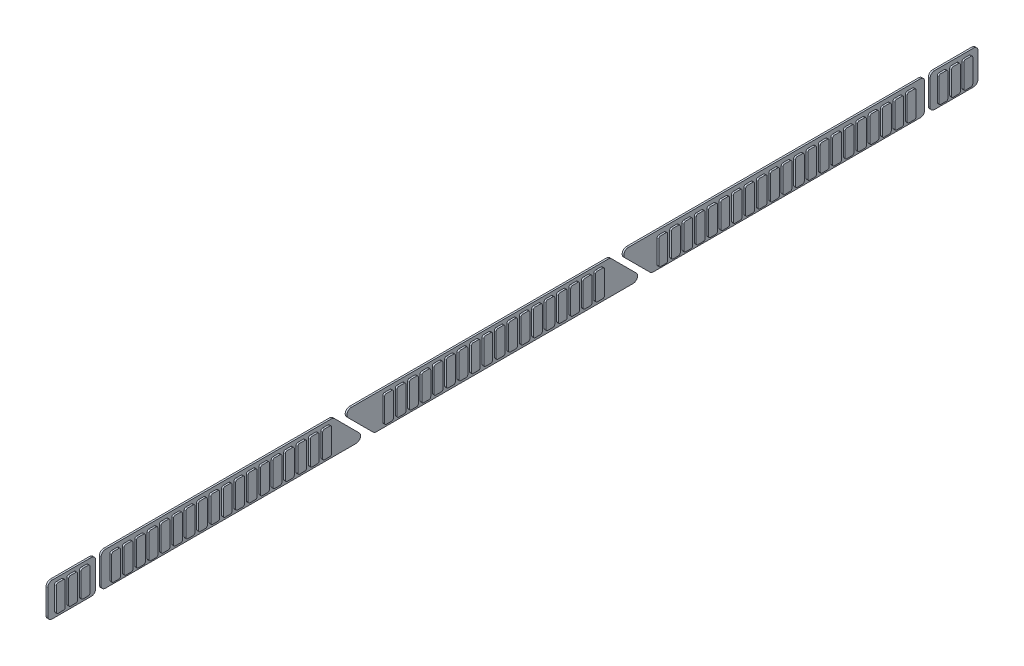
from build123d import *

# Parameters (mm, degrees)
BOSS_EXTRUDE6_DEPTH   = 1
BOSS_EXTRUDE6_2_DEPTH = 1
BOSS_EXTRUDE6_3_DEPTH = 1
BOSS_EXTRUDE6_4_DEPTH = 1
BOSS_EXTRUDE6_5_DEPTH = 1
BOSS_EXTRUDE7_DEPTH   = 1


with BuildPart() as part:
    # Sketch1 → Boss-Extrude6 (new body)
    with BuildSketch(Plane(origin=(0, 0, 0), x_dir=(0, 0, -1), z_dir=(1, 0, 0))):
        with BuildLine():
            Line((-262, 7), (-262, -7))
            ThreePointArc((-262, -7), (-261.267766953, -8.767766953), (-259.5, -9.5))
            Line((-259.5, -9.5), (-237.5, -9.5))
            ThreePointArc((-237.5, -9.5), (-235.732233047, -8.767766953), (-235, -7))
            Line((-235, -7), (-235, 7))
            ThreePointArc((-235, 7), (-235.732233047, 8.767766953), (-237.5, 9.5))
            Line((-237.5, 9.5), (-259.5, 9.5))
            ThreePointArc((-259.5, 9.5), (-261.267766953, 8.767766953), (-262, 7))
        make_face()
    extrude(amount=-BOSS_EXTRUDE6_DEPTH)



with BuildPart() as body_2:
    # Sketch1 → Boss-Extrude6 2 (new body)
    with BuildSketch(Plane(origin=(0, 0, 0), x_dir=(0, 0, -1), z_dir=(1, 0, 0))):
        with BuildLine():
            ThreePointArc((259.5, -9.5), (261.267766953, -8.767766953), (262, -7))
            Line((262, -7), (262, 7))
            ThreePointArc((262, 7), (261.267766953, 8.767766953), (259.5, 9.5))
            Line((259.5, 9.5), (237.5, 9.5))
            ThreePointArc((237.5, 9.5), (235.732233047, 8.767766953), (235, 7))
            Line((235, 7), (235, -7))
            ThreePointArc((235, -7), (235.732233047, -8.767766953), (237.5, -9.5))
            Line((237.5, -9.5), (259.5, -9.5))
        make_face()
    extrude(amount=-BOSS_EXTRUDE6_2_DEPTH)


with BuildPart() as body_3:
    # Sketch1 → Boss-Extrude6 3 (new body)
    with BuildSketch(Plane(origin=(0, 0, 0), x_dir=(0, 0, -1), z_dir=(1, 0, 0))):
        with BuildLine():
            ThreePointArc((-229.5, 9.5), (-231.267766953, 8.767766953), (-232, 7))
            Line((-232, 7), (-232, -7))
            ThreePointArc((-232, -7), (-231.267766953, -8.767766953), (-229.5, -9.5))
            Line((-229.5, -9.5), (-88.278174593, -9.5))
            ThreePointArc((-88.278174593, -9.5), (-85.968475762, -7.956708581), (-86.51040764, -5.232233047))
            Line((-86.51040764, -5.232233047), (-100.51040764, 8.767766953))
            ThreePointArc((-100.51040764, 8.767766953), (-101.321466012, 9.309698831), (-102.278174593, 9.5))
            Line((-102.278174593, 9.5), (-229.5, 9.5))
        make_face()
    extrude(amount=-BOSS_EXTRUDE6_3_DEPTH)


with BuildPart() as body_4:
    # Sketch1 → Boss-Extrude6 4 (new body)
    with BuildSketch(Plane(origin=(0, 0, 0), x_dir=(0, 0, -1), z_dir=(1, 0, 0))):
        with BuildLine():
            ThreePointArc((-78.732233047, -8.767766953), (-77.921174675, -9.309698831), (-76.964466094, -9.5))
            Line((-76.964466094, -9.5), (67.721825407, -9.5))
            ThreePointArc((67.721825407, -9.5), (70.031524238, -7.956708581), (69.48959236, -5.232233047))
            Line((69.48959236, -5.232233047), (55.48959236, 8.767766953))
            ThreePointArc((55.48959236, 8.767766953), (54.678533988, 9.309698831), (53.721825407, 9.5))
            Line((53.721825407, 9.5), (-90.964466094, 9.5))
            ThreePointArc((-90.964466094, 9.5), (-93.274164925, 7.956708581), (-92.732233047, 5.232233047))
            Line((-92.732233047, 5.232233047), (-78.732233047, -8.767766953))
        make_face()
    extrude(amount=-BOSS_EXTRUDE6_4_DEPTH)


with BuildPart() as body_5:
    # Sketch1 → Boss-Extrude6 5 (new body)
    with BuildSketch(Plane(origin=(0, 0, 0), x_dir=(0, 0, -1), z_dir=(1, 0, 0))):
        with BuildLine():
            Line((232, -7), (232, 7))
            ThreePointArc((232, 7), (231.267766953, 8.767766953), (229.5, 9.5))
            Line((229.5, 9.5), (65.035533906, 9.5))
            ThreePointArc((65.035533906, 9.5), (62.725835075, 7.956708581), (63.267766953, 5.232233047))
            Line((63.267766953, 5.232233047), (77.267766953, -8.767766953))
            ThreePointArc((77.267766953, -8.767766953), (78.078825325, -9.309698831), (79.035533906, -9.5))
            Line((79.035533906, -9.5), (229.5, -9.5))
            ThreePointArc((229.5, -9.5), (231.267766953, -8.767766953), (232, -7))
        make_face()
    extrude(amount=-BOSS_EXTRUDE6_5_DEPTH)


with BuildPart() as part_1:
    add(part.part)

    add(body_2.part)  # Boss-Extrude7 merges body 2

    add(body_3.part)  # Boss-Extrude7 merges body 3

    add(body_4.part)  # Boss-Extrude7 merges body 4

    add(body_5.part)  # Boss-Extrude7 merges body 5
    # Sketch1<9> → Boss-Extrude7 (add)
    with BuildSketch(Plane(origin=(0, 0, 0), x_dir=(0, 0, -1), z_dir=(1, 0, 0))):
        with BuildLine():
            Line((-254.193203151, 7.577779114), (-257.193203151, 7.577779114))
            ThreePointArc((-257.193203151, 7.577779114), (-257.900309932, 7.284885895), (-258.193203151, 6.577779114))
            Line((-258.193203151, 6.577779114), (-258.193203151, -6.422220886))
            ThreePointArc((-258.193203151, -6.422220886), (-257.900309932, -7.129327668), (-257.193203151, -7.422220886))
            Line((-257.193203151, -7.422220886), (-254.193203151, -7.422220886))
            ThreePointArc((-254.193203151, -7.422220886), (-253.48609637, -7.129327668), (-253.193203151, -6.422220886))
            Line((-253.193203151, -6.422220886), (-253.193203151, 6.577779114))
            ThreePointArc((-253.193203151, 6.577779114), (-253.48609637, 7.284885895), (-254.193203151, 7.577779114))
        make_face()
        with BuildLine():
            Line((-247.193203151, 7.577779114), (-250.193203151, 7.577779114))
            ThreePointArc((-250.193203151, 7.577779114), (-250.900309932, 7.284885895), (-251.193203151, 6.577779114))
            Line((-251.193203151, 6.577779114), (-251.193203151, -6.422220886))
            ThreePointArc((-251.193203151, -6.422220886), (-250.900309932, -7.129327668), (-250.193203151, -7.422220886))
            Line((-250.193203151, -7.422220886), (-247.193203151, -7.422220886))
            ThreePointArc((-247.193203151, -7.422220886), (-246.48609637, -7.129327668), (-246.193203151, -6.422220886))
            Line((-246.193203151, -6.422220886), (-246.193203151, 6.577779114))
            ThreePointArc((-246.193203151, 6.577779114), (-246.48609637, 7.284885895), (-247.193203151, 7.577779114))
        make_face()
        with BuildLine():
            Line((-240.193203151, 7.577779114), (-243.193203151, 7.577779114))
            ThreePointArc((-243.193203151, 7.577779114), (-243.900309932, 7.284885895), (-244.193203151, 6.577779114))
            Line((-244.193203151, 6.577779114), (-244.193203151, -6.422220886))
            ThreePointArc((-244.193203151, -6.422220886), (-243.900309932, -7.129327668), (-243.193203151, -7.422220886))
            Line((-243.193203151, -7.422220886), (-240.193203151, -7.422220886))
            ThreePointArc((-240.193203151, -7.422220886), (-239.48609637, -7.129327668), (-239.193203151, -6.422220886))
            Line((-239.193203151, -6.422220886), (-239.193203151, 6.577779114))
            ThreePointArc((-239.193203151, 6.577779114), (-239.48609637, 7.284885895), (-240.193203151, 7.577779114))
        make_face()
        with BuildLine():
            Line((-222.991592166, 7.16130422), (-225.991592166, 7.16130422))
            ThreePointArc((-225.991592166, 7.16130422), (-226.698698947, 6.868411001), (-226.991592166, 6.16130422))
            Line((-226.991592166, 6.16130422), (-226.991592166, -6.83869578))
            ThreePointArc((-226.991592166, -6.83869578), (-226.698698947, -7.545802561), (-225.991592166, -7.83869578))
            Line((-225.991592166, -7.83869578), (-222.991592166, -7.83869578))
            ThreePointArc((-222.991592166, -7.83869578), (-222.284485385, -7.545802561), (-221.991592166, -6.83869578))
            Line((-221.991592166, -6.83869578), (-221.991592166, 6.16130422))
            ThreePointArc((-221.991592166, 6.16130422), (-222.284485385, 6.868411001), (-222.991592166, 7.16130422))
        make_face()
        with BuildLine():
            Line((-215.991592166, 7.16130422), (-218.991592166, 7.16130422))
            ThreePointArc((-218.991592166, 7.16130422), (-219.698698947, 6.868411001), (-219.991592166, 6.16130422))
            Line((-219.991592166, 6.16130422), (-219.991592166, -6.83869578))
            ThreePointArc((-219.991592166, -6.83869578), (-219.698698947, -7.545802561), (-218.991592166, -7.83869578))
            Line((-218.991592166, -7.83869578), (-215.991592166, -7.83869578))
            ThreePointArc((-215.991592166, -7.83869578), (-215.284485385, -7.545802561), (-214.991592166, -6.83869578))
            Line((-214.991592166, -6.83869578), (-214.991592166, 6.16130422))
            ThreePointArc((-214.991592166, 6.16130422), (-215.284485385, 6.868411001), (-215.991592166, 7.16130422))
        make_face()
        with BuildLine():
            Line((-208.991592166, 7.16130422), (-211.991592166, 7.16130422))
            ThreePointArc((-211.991592166, 7.16130422), (-212.698698947, 6.868411001), (-212.991592166, 6.16130422))
            Line((-212.991592166, 6.16130422), (-212.991592166, -6.83869578))
            ThreePointArc((-212.991592166, -6.83869578), (-212.698698947, -7.545802561), (-211.991592166, -7.83869578))
            Line((-211.991592166, -7.83869578), (-208.991592166, -7.83869578))
            ThreePointArc((-208.991592166, -7.83869578), (-208.284485385, -7.545802561), (-207.991592166, -6.83869578))
            Line((-207.991592166, -6.83869578), (-207.991592166, 6.16130422))
            ThreePointArc((-207.991592166, 6.16130422), (-208.284485385, 6.868411001), (-208.991592166, 7.16130422))
        make_face()
        with BuildLine():
            Line((-201.991592166, 7.16130422), (-204.991592166, 7.16130422))
            ThreePointArc((-204.991592166, 7.16130422), (-205.698698947, 6.868411001), (-205.991592166, 6.16130422))
            Line((-205.991592166, 6.16130422), (-205.991592166, -6.83869578))
            ThreePointArc((-205.991592166, -6.83869578), (-205.698698947, -7.545802561), (-204.991592166, -7.83869578))
            Line((-204.991592166, -7.83869578), (-201.991592166, -7.83869578))
            ThreePointArc((-201.991592166, -7.83869578), (-201.284485385, -7.545802561), (-200.991592166, -6.83869578))
            Line((-200.991592166, -6.83869578), (-200.991592166, 6.16130422))
            ThreePointArc((-200.991592166, 6.16130422), (-201.284485385, 6.868411001), (-201.991592166, 7.16130422))
        make_face()
        with BuildLine():
            Line((-195.138299605, 7.469188009), (-198.138299605, 7.469188009))
            ThreePointArc((-198.138299605, 7.469188009), (-198.845406387, 7.17629479), (-199.138299605, 6.469188009))
            Line((-199.138299605, 6.469188009), (-199.138299605, -6.530811991))
            ThreePointArc((-199.138299605, -6.530811991), (-198.845406387, -7.237918772), (-198.138299605, -7.530811991))
            Line((-198.138299605, -7.530811991), (-195.138299605, -7.530811991))
            ThreePointArc((-195.138299605, -7.530811991), (-194.431192824, -7.237918772), (-194.138299605, -6.530811991))
            Line((-194.138299605, -6.530811991), (-194.138299605, 6.469188009))
            ThreePointArc((-194.138299605, 6.469188009), (-194.431192824, 7.17629479), (-195.138299605, 7.469188009))
        make_face()
        with BuildLine():
            Line((-188.138299605, 7.469188009), (-191.138299605, 7.469188009))
            ThreePointArc((-191.138299605, 7.469188009), (-191.845406387, 7.17629479), (-192.138299605, 6.469188009))
            Line((-192.138299605, 6.469188009), (-192.138299605, -6.530811991))
            ThreePointArc((-192.138299605, -6.530811991), (-191.845406387, -7.237918772), (-191.138299605, -7.530811991))
            Line((-191.138299605, -7.530811991), (-188.138299605, -7.530811991))
            ThreePointArc((-188.138299605, -7.530811991), (-187.431192824, -7.237918772), (-187.138299605, -6.530811991))
            Line((-187.138299605, -6.530811991), (-187.138299605, 6.469188009))
            ThreePointArc((-187.138299605, 6.469188009), (-187.431192824, 7.17629479), (-188.138299605, 7.469188009))
        make_face()
        with BuildLine():
            Line((-181.138299605, 7.469188009), (-184.138299605, 7.469188009))
            ThreePointArc((-184.138299605, 7.469188009), (-184.845406387, 7.17629479), (-185.138299605, 6.469188009))
            Line((-185.138299605, 6.469188009), (-185.138299605, -6.530811991))
            ThreePointArc((-185.138299605, -6.530811991), (-184.845406387, -7.237918772), (-184.138299605, -7.530811991))
            Line((-184.138299605, -7.530811991), (-181.138299605, -7.530811991))
            ThreePointArc((-181.138299605, -7.530811991), (-180.431192824, -7.237918772), (-180.138299605, -6.530811991))
            Line((-180.138299605, -6.530811991), (-180.138299605, 6.469188009))
            ThreePointArc((-180.138299605, 6.469188009), (-180.431192824, 7.17629479), (-181.138299605, 7.469188009))
        make_face()
        with BuildLine():
            Line((-174.138299605, 7.469188009), (-177.138299605, 7.469188009))
            ThreePointArc((-177.138299605, 7.469188009), (-177.845406387, 7.17629479), (-178.138299605, 6.469188009))
            Line((-178.138299605, 6.469188009), (-178.138299605, -6.530811991))
            ThreePointArc((-178.138299605, -6.530811991), (-177.845406387, -7.237918772), (-177.138299605, -7.530811991))
            Line((-177.138299605, -7.530811991), (-174.138299605, -7.530811991))
            ThreePointArc((-174.138299605, -7.530811991), (-173.431192824, -7.237918772), (-173.138299605, -6.530811991))
            Line((-173.138299605, -6.530811991), (-173.138299605, 6.469188009))
            ThreePointArc((-173.138299605, 6.469188009), (-173.431192824, 7.17629479), (-174.138299605, 7.469188009))
        make_face()
        with BuildLine():
            Line((-167.138299605, 7.469188009), (-170.138299605, 7.469188009))
            ThreePointArc((-170.138299605, 7.469188009), (-170.845406387, 7.17629479), (-171.138299605, 6.469188009))
            Line((-171.138299605, 6.469188009), (-171.138299605, -6.530811991))
            ThreePointArc((-171.138299605, -6.530811991), (-170.845406387, -7.237918772), (-170.138299605, -7.530811991))
            Line((-170.138299605, -7.530811991), (-167.138299605, -7.530811991))
            ThreePointArc((-167.138299605, -7.530811991), (-166.431192824, -7.237918772), (-166.138299605, -6.530811991))
            Line((-166.138299605, -6.530811991), (-166.138299605, 6.469188009))
            ThreePointArc((-166.138299605, 6.469188009), (-166.431192824, 7.17629479), (-167.138299605, 7.469188009))
        make_face()
        with BuildLine():
            Line((-160.138299605, 7.469188009), (-163.138299605, 7.469188009))
            ThreePointArc((-163.138299605, 7.469188009), (-163.845406387, 7.17629479), (-164.138299605, 6.469188009))
            Line((-164.138299605, 6.469188009), (-164.138299605, -6.530811991))
            ThreePointArc((-164.138299605, -6.530811991), (-163.845406387, -7.237918772), (-163.138299605, -7.530811991))
            Line((-163.138299605, -7.530811991), (-160.138299605, -7.530811991))
            ThreePointArc((-160.138299605, -7.530811991), (-159.431192824, -7.237918772), (-159.138299605, -6.530811991))
            Line((-159.138299605, -6.530811991), (-159.138299605, 6.469188009))
            ThreePointArc((-159.138299605, 6.469188009), (-159.431192824, 7.17629479), (-160.138299605, 7.469188009))
        make_face()
        with BuildLine():
            Line((-153.138299605, 7.469188009), (-156.138299605, 7.469188009))
            ThreePointArc((-156.138299605, 7.469188009), (-156.845406387, 7.17629479), (-157.138299605, 6.469188009))
            Line((-157.138299605, 6.469188009), (-157.138299605, -6.530811991))
            ThreePointArc((-157.138299605, -6.530811991), (-156.845406387, -7.237918772), (-156.138299605, -7.530811991))
            Line((-156.138299605, -7.530811991), (-153.138299605, -7.530811991))
            ThreePointArc((-153.138299605, -7.530811991), (-152.431192824, -7.237918772), (-152.138299605, -6.530811991))
            Line((-152.138299605, -6.530811991), (-152.138299605, 6.469188009))
            ThreePointArc((-152.138299605, 6.469188009), (-152.431192824, 7.17629479), (-153.138299605, 7.469188009))
        make_face()
        with BuildLine():
            Line((-146.138299605, 7.469188009), (-149.138299605, 7.469188009))
            ThreePointArc((-149.138299605, 7.469188009), (-149.845406387, 7.17629479), (-150.138299605, 6.469188009))
            Line((-150.138299605, 6.469188009), (-150.138299605, -6.530811991))
            ThreePointArc((-150.138299605, -6.530811991), (-149.845406387, -7.237918772), (-149.138299605, -7.530811991))
            Line((-149.138299605, -7.530811991), (-146.138299605, -7.530811991))
            ThreePointArc((-146.138299605, -7.530811991), (-145.431192824, -7.237918772), (-145.138299605, -6.530811991))
            Line((-145.138299605, -6.530811991), (-145.138299605, 6.469188009))
            ThreePointArc((-145.138299605, 6.469188009), (-145.431192824, 7.17629479), (-146.138299605, 7.469188009))
        make_face()
        with BuildLine():
            Line((-139.138299605, 7.469188009), (-142.138299605, 7.469188009))
            ThreePointArc((-142.138299605, 7.469188009), (-142.845406387, 7.17629479), (-143.138299605, 6.469188009))
            Line((-143.138299605, 6.469188009), (-143.138299605, -6.530811991))
            ThreePointArc((-143.138299605, -6.530811991), (-142.845406387, -7.237918772), (-142.138299605, -7.530811991))
            Line((-142.138299605, -7.530811991), (-139.138299605, -7.530811991))
            ThreePointArc((-139.138299605, -7.530811991), (-138.431192824, -7.237918772), (-138.138299605, -6.530811991))
            Line((-138.138299605, -6.530811991), (-138.138299605, 6.469188009))
            ThreePointArc((-138.138299605, 6.469188009), (-138.431192824, 7.17629479), (-139.138299605, 7.469188009))
        make_face()
        with BuildLine():
            Line((-132.138299605, 7.469188009), (-135.138299605, 7.469188009))
            ThreePointArc((-135.138299605, 7.469188009), (-135.845406387, 7.17629479), (-136.138299605, 6.469188009))
            Line((-136.138299605, 6.469188009), (-136.138299605, -6.530811991))
            ThreePointArc((-136.138299605, -6.530811991), (-135.845406387, -7.237918772), (-135.138299605, -7.530811991))
            Line((-135.138299605, -7.530811991), (-132.138299605, -7.530811991))
            ThreePointArc((-132.138299605, -7.530811991), (-131.431192824, -7.237918772), (-131.138299605, -6.530811991))
            Line((-131.138299605, -6.530811991), (-131.138299605, 6.469188009))
            ThreePointArc((-131.138299605, 6.469188009), (-131.431192824, 7.17629479), (-132.138299605, 7.469188009))
        make_face()
        with BuildLine():
            Line((-125.138299605, 7.469188009), (-128.138299605, 7.469188009))
            ThreePointArc((-128.138299605, 7.469188009), (-128.845406387, 7.17629479), (-129.138299605, 6.469188009))
            Line((-129.138299605, 6.469188009), (-129.138299605, -6.530811991))
            ThreePointArc((-129.138299605, -6.530811991), (-128.845406387, -7.237918772), (-128.138299605, -7.530811991))
            Line((-128.138299605, -7.530811991), (-125.138299605, -7.530811991))
            ThreePointArc((-125.138299605, -7.530811991), (-124.431192824, -7.237918772), (-124.138299605, -6.530811991))
            Line((-124.138299605, -6.530811991), (-124.138299605, 6.469188009))
            ThreePointArc((-124.138299605, 6.469188009), (-124.431192824, 7.17629479), (-125.138299605, 7.469188009))
        make_face()
        with BuildLine():
            Line((-118.138299605, 7.469188009), (-121.138299605, 7.469188009))
            ThreePointArc((-121.138299605, 7.469188009), (-121.845406387, 7.17629479), (-122.138299605, 6.469188009))
            Line((-122.138299605, 6.469188009), (-122.138299605, -6.530811991))
            ThreePointArc((-122.138299605, -6.530811991), (-121.845406387, -7.237918772), (-121.138299605, -7.530811991))
            Line((-121.138299605, -7.530811991), (-118.138299605, -7.530811991))
            ThreePointArc((-118.138299605, -7.530811991), (-117.431192824, -7.237918772), (-117.138299605, -6.530811991))
            Line((-117.138299605, -6.530811991), (-117.138299605, 6.469188009))
            ThreePointArc((-117.138299605, 6.469188009), (-117.431192824, 7.17629479), (-118.138299605, 7.469188009))
        make_face()
        with BuildLine():
            Line((-111.138299605, 7.469188009), (-114.138299605, 7.469188009))
            ThreePointArc((-114.138299605, 7.469188009), (-114.845406387, 7.17629479), (-115.138299605, 6.469188009))
            Line((-115.138299605, 6.469188009), (-115.138299605, -6.530811991))
            ThreePointArc((-115.138299605, -6.530811991), (-114.845406387, -7.237918772), (-114.138299605, -7.530811991))
            Line((-114.138299605, -7.530811991), (-111.138299605, -7.530811991))
            ThreePointArc((-111.138299605, -7.530811991), (-110.431192824, -7.237918772), (-110.138299605, -6.530811991))
            Line((-110.138299605, -6.530811991), (-110.138299605, 6.469188009))
            ThreePointArc((-110.138299605, 6.469188009), (-110.431192824, 7.17629479), (-111.138299605, 7.469188009))
        make_face()
        with BuildLine():
            Line((-104.138299605, 7.469188009), (-107.138299605, 7.469188009))
            ThreePointArc((-107.138299605, 7.469188009), (-107.845406387, 7.17629479), (-108.138299605, 6.469188009))
            Line((-108.138299605, 6.469188009), (-108.138299605, -6.530811991))
            ThreePointArc((-108.138299605, -6.530811991), (-107.845406387, -7.237918772), (-107.138299605, -7.530811991))
            Line((-107.138299605, -7.530811991), (-104.138299605, -7.530811991))
            ThreePointArc((-104.138299605, -7.530811991), (-103.431192824, -7.237918772), (-103.138299605, -6.530811991))
            Line((-103.138299605, -6.530811991), (-103.138299605, 6.469188009))
            ThreePointArc((-103.138299605, 6.469188009), (-103.431192824, 7.17629479), (-104.138299605, 7.469188009))
        make_face()
        with BuildLine():
            Line((-69.26358478, 7.369918004), (-72.26358478, 7.369918004))
            ThreePointArc((-72.26358478, 7.369918004), (-72.970691561, 7.077024785), (-73.26358478, 6.369918004))
            Line((-73.26358478, 6.369918004), (-73.26358478, -6.630081996))
            ThreePointArc((-73.26358478, -6.630081996), (-72.970691561, -7.337188777), (-72.26358478, -7.630081996))
            Line((-72.26358478, -7.630081996), (-69.26358478, -7.630081996))
            ThreePointArc((-69.26358478, -7.630081996), (-68.556477999, -7.337188777), (-68.26358478, -6.630081996))
            Line((-68.26358478, -6.630081996), (-68.26358478, 6.369918004))
            ThreePointArc((-68.26358478, 6.369918004), (-68.556477999, 7.077024785), (-69.26358478, 7.369918004))
        make_face()
        with BuildLine():
            Line((-62.26358478, 7.369918004), (-65.26358478, 7.369918004))
            ThreePointArc((-65.26358478, 7.369918004), (-65.970691561, 7.077024785), (-66.26358478, 6.369918004))
            Line((-66.26358478, 6.369918004), (-66.26358478, -6.630081996))
            ThreePointArc((-66.26358478, -6.630081996), (-65.970691561, -7.337188777), (-65.26358478, -7.630081996))
            Line((-65.26358478, -7.630081996), (-62.26358478, -7.630081996))
            ThreePointArc((-62.26358478, -7.630081996), (-61.556477999, -7.337188777), (-61.26358478, -6.630081996))
            Line((-61.26358478, -6.630081996), (-61.26358478, 6.369918004))
            ThreePointArc((-61.26358478, 6.369918004), (-61.556477999, 7.077024785), (-62.26358478, 7.369918004))
        make_face()
        with BuildLine():
            Line((-55.26358478, 7.369918004), (-58.26358478, 7.369918004))
            ThreePointArc((-58.26358478, 7.369918004), (-58.970691561, 7.077024785), (-59.26358478, 6.369918004))
            Line((-59.26358478, 6.369918004), (-59.26358478, -6.630081996))
            ThreePointArc((-59.26358478, -6.630081996), (-58.970691561, -7.337188777), (-58.26358478, -7.630081996))
            Line((-58.26358478, -7.630081996), (-55.26358478, -7.630081996))
            ThreePointArc((-55.26358478, -7.630081996), (-54.556477999, -7.337188777), (-54.26358478, -6.630081996))
            Line((-54.26358478, -6.630081996), (-54.26358478, 6.369918004))
            ThreePointArc((-54.26358478, 6.369918004), (-54.556477999, 7.077024785), (-55.26358478, 7.369918004))
        make_face()
        with BuildLine():
            Line((-48.26358478, 7.369918004), (-51.26358478, 7.369918004))
            ThreePointArc((-51.26358478, 7.369918004), (-51.970691561, 7.077024785), (-52.26358478, 6.369918004))
            Line((-52.26358478, 6.369918004), (-52.26358478, -6.630081996))
            ThreePointArc((-52.26358478, -6.630081996), (-51.970691561, -7.337188777), (-51.26358478, -7.630081996))
            Line((-51.26358478, -7.630081996), (-48.26358478, -7.630081996))
            ThreePointArc((-48.26358478, -7.630081996), (-47.556477999, -7.337188777), (-47.26358478, -6.630081996))
            Line((-47.26358478, -6.630081996), (-47.26358478, 6.369918004))
            ThreePointArc((-47.26358478, 6.369918004), (-47.556477999, 7.077024785), (-48.26358478, 7.369918004))
        make_face()
        with BuildLine():
            Line((-41.410292219, 7.677801793), (-44.410292219, 7.677801793))
            ThreePointArc((-44.410292219, 7.677801793), (-45.117399, 7.384908574), (-45.410292219, 6.677801793))
            Line((-45.410292219, 6.677801793), (-45.410292219, -6.322198207))
            ThreePointArc((-45.410292219, -6.322198207), (-45.117399, -7.029304988), (-44.410292219, -7.322198207))
            Line((-44.410292219, -7.322198207), (-41.410292219, -7.322198207))
            ThreePointArc((-41.410292219, -7.322198207), (-40.703185438, -7.029304988), (-40.410292219, -6.322198207))
            Line((-40.410292219, -6.322198207), (-40.410292219, 6.677801793))
            ThreePointArc((-40.410292219, 6.677801793), (-40.703185438, 7.384908574), (-41.410292219, 7.677801793))
        make_face()
        with BuildLine():
            Line((-34.410292219, 7.677801793), (-37.410292219, 7.677801793))
            ThreePointArc((-37.410292219, 7.677801793), (-38.117399, 7.384908574), (-38.410292219, 6.677801793))
            Line((-38.410292219, 6.677801793), (-38.410292219, -6.322198207))
            ThreePointArc((-38.410292219, -6.322198207), (-38.117399, -7.029304988), (-37.410292219, -7.322198207))
            Line((-37.410292219, -7.322198207), (-34.410292219, -7.322198207))
            ThreePointArc((-34.410292219, -7.322198207), (-33.703185438, -7.029304988), (-33.410292219, -6.322198207))
            Line((-33.410292219, -6.322198207), (-33.410292219, 6.677801793))
            ThreePointArc((-33.410292219, 6.677801793), (-33.703185438, 7.384908574), (-34.410292219, 7.677801793))
        make_face()
        with BuildLine():
            Line((-27.410292219, 7.677801793), (-30.410292219, 7.677801793))
            ThreePointArc((-30.410292219, 7.677801793), (-31.117399, 7.384908574), (-31.410292219, 6.677801793))
            Line((-31.410292219, 6.677801793), (-31.410292219, -6.322198207))
            ThreePointArc((-31.410292219, -6.322198207), (-31.117399, -7.029304988), (-30.410292219, -7.322198207))
            Line((-30.410292219, -7.322198207), (-27.410292219, -7.322198207))
            ThreePointArc((-27.410292219, -7.322198207), (-26.703185438, -7.029304988), (-26.410292219, -6.322198207))
            Line((-26.410292219, -6.322198207), (-26.410292219, 6.677801793))
            ThreePointArc((-26.410292219, 6.677801793), (-26.703185438, 7.384908574), (-27.410292219, 7.677801793))
        make_face()
        with BuildLine():
            Line((-20.410292219, 7.677801793), (-23.410292219, 7.677801793))
            ThreePointArc((-23.410292219, 7.677801793), (-24.117399, 7.384908574), (-24.410292219, 6.677801793))
            Line((-24.410292219, 6.677801793), (-24.410292219, -6.322198207))
            ThreePointArc((-24.410292219, -6.322198207), (-24.117399, -7.029304988), (-23.410292219, -7.322198207))
            Line((-23.410292219, -7.322198207), (-20.410292219, -7.322198207))
            ThreePointArc((-20.410292219, -7.322198207), (-19.703185438, -7.029304988), (-19.410292219, -6.322198207))
            Line((-19.410292219, -6.322198207), (-19.410292219, 6.677801793))
            ThreePointArc((-19.410292219, 6.677801793), (-19.703185438, 7.384908574), (-20.410292219, 7.677801793))
        make_face()
        with BuildLine():
            Line((-13.410292219, 7.677801793), (-16.410292219, 7.677801793))
            ThreePointArc((-16.410292219, 7.677801793), (-17.117399, 7.384908574), (-17.410292219, 6.677801793))
            Line((-17.410292219, 6.677801793), (-17.410292219, -6.322198207))
            ThreePointArc((-17.410292219, -6.322198207), (-17.117399, -7.029304988), (-16.410292219, -7.322198207))
            Line((-16.410292219, -7.322198207), (-13.410292219, -7.322198207))
            ThreePointArc((-13.410292219, -7.322198207), (-12.703185438, -7.029304988), (-12.410292219, -6.322198207))
            Line((-12.410292219, -6.322198207), (-12.410292219, 6.677801793))
            ThreePointArc((-12.410292219, 6.677801793), (-12.703185438, 7.384908574), (-13.410292219, 7.677801793))
        make_face()
        with BuildLine():
            Line((-6.410292219, 7.677801793), (-9.410292219, 7.677801793))
            ThreePointArc((-9.410292219, 7.677801793), (-10.117399, 7.384908574), (-10.410292219, 6.677801793))
            Line((-10.410292219, 6.677801793), (-10.410292219, -6.322198207))
            ThreePointArc((-10.410292219, -6.322198207), (-10.117399, -7.029304988), (-9.410292219, -7.322198207))
            Line((-9.410292219, -7.322198207), (-6.410292219, -7.322198207))
            ThreePointArc((-6.410292219, -7.322198207), (-5.703185438, -7.029304988), (-5.410292219, -6.322198207))
            Line((-5.410292219, -6.322198207), (-5.410292219, 6.677801793))
            ThreePointArc((-5.410292219, 6.677801793), (-5.703185438, 7.384908574), (-6.410292219, 7.677801793))
        make_face()
        with BuildLine():
            Line((0.589707781, 7.677801793), (-2.410292219, 7.677801793))
            ThreePointArc((-2.410292219, 7.677801793), (-3.117399, 7.384908574), (-3.410292219, 6.677801793))
            Line((-3.410292219, 6.677801793), (-3.410292219, -6.322198207))
            ThreePointArc((-3.410292219, -6.322198207), (-3.117399, -7.029304988), (-2.410292219, -7.322198207))
            Line((-2.410292219, -7.322198207), (0.589707781, -7.322198207))
            ThreePointArc((0.589707781, -7.322198207), (1.296814562, -7.029304988), (1.589707781, -6.322198207))
            Line((1.589707781, -6.322198207), (1.589707781, 6.677801793))
            ThreePointArc((1.589707781, 6.677801793), (1.296814562, 7.384908574), (0.589707781, 7.677801793))
        make_face()
        with BuildLine():
            Line((7.589707781, 7.677801793), (4.589707781, 7.677801793))
            ThreePointArc((4.589707781, 7.677801793), (3.882601, 7.384908574), (3.589707781, 6.677801793))
            Line((3.589707781, 6.677801793), (3.589707781, -6.322198207))
            ThreePointArc((3.589707781, -6.322198207), (3.882601, -7.029304988), (4.589707781, -7.322198207))
            Line((4.589707781, -7.322198207), (7.589707781, -7.322198207))
            ThreePointArc((7.589707781, -7.322198207), (8.296814562, -7.029304988), (8.589707781, -6.322198207))
            Line((8.589707781, -6.322198207), (8.589707781, 6.677801793))
            ThreePointArc((8.589707781, 6.677801793), (8.296814562, 7.384908574), (7.589707781, 7.677801793))
        make_face()
        with BuildLine():
            Line((14.589707781, 7.677801793), (11.589707781, 7.677801793))
            ThreePointArc((11.589707781, 7.677801793), (10.882601, 7.384908574), (10.589707781, 6.677801793))
            Line((10.589707781, 6.677801793), (10.589707781, -6.322198207))
            ThreePointArc((10.589707781, -6.322198207), (10.882601, -7.029304988), (11.589707781, -7.322198207))
            Line((11.589707781, -7.322198207), (14.589707781, -7.322198207))
            ThreePointArc((14.589707781, -7.322198207), (15.296814562, -7.029304988), (15.589707781, -6.322198207))
            Line((15.589707781, -6.322198207), (15.589707781, 6.677801793))
            ThreePointArc((15.589707781, 6.677801793), (15.296814562, 7.384908574), (14.589707781, 7.677801793))
        make_face()
        with BuildLine():
            Line((21.589707781, 7.677801793), (18.589707781, 7.677801793))
            ThreePointArc((18.589707781, 7.677801793), (17.882601, 7.384908574), (17.589707781, 6.677801793))
            Line((17.589707781, 6.677801793), (17.589707781, -6.322198207))
            ThreePointArc((17.589707781, -6.322198207), (17.882601, -7.029304988), (18.589707781, -7.322198207))
            Line((18.589707781, -7.322198207), (21.589707781, -7.322198207))
            ThreePointArc((21.589707781, -7.322198207), (22.296814562, -7.029304988), (22.589707781, -6.322198207))
            Line((22.589707781, -6.322198207), (22.589707781, 6.677801793))
            ThreePointArc((22.589707781, 6.677801793), (22.296814562, 7.384908574), (21.589707781, 7.677801793))
        make_face()
        with BuildLine():
            Line((28.589707781, 7.677801793), (25.589707781, 7.677801793))
            ThreePointArc((25.589707781, 7.677801793), (24.882601, 7.384908574), (24.589707781, 6.677801793))
            Line((24.589707781, 6.677801793), (24.589707781, -6.322198207))
            ThreePointArc((24.589707781, -6.322198207), (24.882601, -7.029304988), (25.589707781, -7.322198207))
            Line((25.589707781, -7.322198207), (28.589707781, -7.322198207))
            ThreePointArc((28.589707781, -7.322198207), (29.296814562, -7.029304988), (29.589707781, -6.322198207))
            Line((29.589707781, -6.322198207), (29.589707781, 6.677801793))
            ThreePointArc((29.589707781, 6.677801793), (29.296814562, 7.384908574), (28.589707781, 7.677801793))
        make_face()
        with BuildLine():
            Line((35.589707781, 7.677801793), (32.589707781, 7.677801793))
            ThreePointArc((32.589707781, 7.677801793), (31.882601, 7.384908574), (31.589707781, 6.677801793))
            Line((31.589707781, 6.677801793), (31.589707781, -6.322198207))
            ThreePointArc((31.589707781, -6.322198207), (31.882601, -7.029304988), (32.589707781, -7.322198207))
            Line((32.589707781, -7.322198207), (35.589707781, -7.322198207))
            ThreePointArc((35.589707781, -7.322198207), (36.296814562, -7.029304988), (36.589707781, -6.322198207))
            Line((36.589707781, -6.322198207), (36.589707781, 6.677801793))
            ThreePointArc((36.589707781, 6.677801793), (36.296814562, 7.384908574), (35.589707781, 7.677801793))
        make_face()
        with BuildLine():
            Line((42.589707781, 7.677801793), (39.589707781, 7.677801793))
            ThreePointArc((39.589707781, 7.677801793), (38.882601, 7.384908574), (38.589707781, 6.677801793))
            Line((38.589707781, 6.677801793), (38.589707781, -6.322198207))
            ThreePointArc((38.589707781, -6.322198207), (38.882601, -7.029304988), (39.589707781, -7.322198207))
            Line((39.589707781, -7.322198207), (42.589707781, -7.322198207))
            ThreePointArc((42.589707781, -7.322198207), (43.296814562, -7.029304988), (43.589707781, -6.322198207))
            Line((43.589707781, -6.322198207), (43.589707781, 6.677801793))
            ThreePointArc((43.589707781, 6.677801793), (43.296814562, 7.384908574), (42.589707781, 7.677801793))
        make_face()
        with BuildLine():
            Line((49.589707781, 7.677801793), (46.589707781, 7.677801793))
            ThreePointArc((46.589707781, 7.677801793), (45.882601, 7.384908574), (45.589707781, 6.677801793))
            Line((45.589707781, 6.677801793), (45.589707781, -6.322198207))
            ThreePointArc((45.589707781, -6.322198207), (45.882601, -7.029304988), (46.589707781, -7.322198207))
            Line((46.589707781, -7.322198207), (49.589707781, -7.322198207))
            ThreePointArc((49.589707781, -7.322198207), (50.296814562, -7.029304988), (50.589707781, -6.322198207))
            Line((50.589707781, -6.322198207), (50.589707781, 6.677801793))
            ThreePointArc((50.589707781, 6.677801793), (50.296814562, 7.384908574), (49.589707781, 7.677801793))
        make_face()
        with BuildLine():
            Line((92.284036077, 7.221339048), (89.284036077, 7.221339048))
            ThreePointArc((89.284036077, 7.221339048), (88.576929296, 6.928445829), (88.284036077, 6.221339048))
            Line((88.284036077, 6.221339048), (88.284036077, -6.778660952))
            ThreePointArc((88.284036077, -6.778660952), (88.576929296, -7.485767733), (89.284036077, -7.778660952))
            Line((89.284036077, -7.778660952), (92.284036077, -7.778660952))
            ThreePointArc((92.284036077, -7.778660952), (92.991142858, -7.485767733), (93.284036077, -6.778660952))
            Line((93.284036077, -6.778660952), (93.284036077, 6.221339048))
            ThreePointArc((93.284036077, 6.221339048), (92.991142858, 6.928445829), (92.284036077, 7.221339048))
        make_face()
        with BuildLine():
            Line((99.284036077, 7.221339048), (96.284036077, 7.221339048))
            ThreePointArc((96.284036077, 7.221339048), (95.576929296, 6.928445829), (95.284036077, 6.221339048))
            Line((95.284036077, 6.221339048), (95.284036077, -6.778660952))
            ThreePointArc((95.284036077, -6.778660952), (95.576929296, -7.485767733), (96.284036077, -7.778660952))
            Line((96.284036077, -7.778660952), (99.284036077, -7.778660952))
            ThreePointArc((99.284036077, -7.778660952), (99.991142858, -7.485767733), (100.284036077, -6.778660952))
            Line((100.284036077, -6.778660952), (100.284036077, 6.221339048))
            ThreePointArc((100.284036077, 6.221339048), (99.991142858, 6.928445829), (99.284036077, 7.221339048))
        make_face()
        with BuildLine():
            Line((106.284036077, 7.221339048), (103.284036077, 7.221339048))
            ThreePointArc((103.284036077, 7.221339048), (102.576929296, 6.928445829), (102.284036077, 6.221339048))
            Line((102.284036077, 6.221339048), (102.284036077, -6.778660952))
            ThreePointArc((102.284036077, -6.778660952), (102.576929296, -7.485767733), (103.284036077, -7.778660952))
            Line((103.284036077, -7.778660952), (106.284036077, -7.778660952))
            ThreePointArc((106.284036077, -7.778660952), (106.991142858, -7.485767733), (107.284036077, -6.778660952))
            Line((107.284036077, -6.778660952), (107.284036077, 6.221339048))
            ThreePointArc((107.284036077, 6.221339048), (106.991142858, 6.928445829), (106.284036077, 7.221339048))
        make_face()
        with BuildLine():
            Line((113.284036077, 7.221339048), (110.284036077, 7.221339048))
            ThreePointArc((110.284036077, 7.221339048), (109.576929296, 6.928445829), (109.284036077, 6.221339048))
            Line((109.284036077, 6.221339048), (109.284036077, -6.778660952))
            ThreePointArc((109.284036077, -6.778660952), (109.576929296, -7.485767733), (110.284036077, -7.778660952))
            Line((110.284036077, -7.778660952), (113.284036077, -7.778660952))
            ThreePointArc((113.284036077, -7.778660952), (113.991142858, -7.485767733), (114.284036077, -6.778660952))
            Line((114.284036077, -6.778660952), (114.284036077, 6.221339048))
            ThreePointArc((114.284036077, 6.221339048), (113.991142858, 6.928445829), (113.284036077, 7.221339048))
        make_face()
        with BuildLine():
            Line((120.137328638, 7.221339048), (117.137328638, 7.221339048))
            ThreePointArc((117.137328638, 7.221339048), (116.430221857, 6.928445829), (116.137328638, 6.221339048))
            Line((116.137328638, 6.221339048), (116.137328638, -6.778660952))
            ThreePointArc((116.137328638, -6.778660952), (116.430221857, -7.485767733), (117.137328638, -7.778660952))
            Line((117.137328638, -7.778660952), (120.137328638, -7.778660952))
            ThreePointArc((120.137328638, -7.778660952), (120.844435419, -7.485767733), (121.137328638, -6.778660952))
            Line((121.137328638, -6.778660952), (121.137328638, 6.221339048))
            ThreePointArc((121.137328638, 6.221339048), (120.844435419, 6.928445829), (120.137328638, 7.221339048))
        make_face()
        with BuildLine():
            Line((127.137328638, 7.221339048), (124.137328638, 7.221339048))
            ThreePointArc((124.137328638, 7.221339048), (123.430221857, 6.928445829), (123.137328638, 6.221339048))
            Line((123.137328638, 6.221339048), (123.137328638, -6.778660952))
            ThreePointArc((123.137328638, -6.778660952), (123.430221857, -7.485767733), (124.137328638, -7.778660952))
            Line((124.137328638, -7.778660952), (127.137328638, -7.778660952))
            ThreePointArc((127.137328638, -7.778660952), (127.844435419, -7.485767733), (128.137328638, -6.778660952))
            Line((128.137328638, -6.778660952), (128.137328638, 6.221339048))
            ThreePointArc((128.137328638, 6.221339048), (127.844435419, 6.928445829), (127.137328638, 7.221339048))
        make_face()
        with BuildLine():
            Line((134.137328638, 7.221339048), (131.137328638, 7.221339048))
            ThreePointArc((131.137328638, 7.221339048), (130.430221857, 6.928445829), (130.137328638, 6.221339048))
            Line((130.137328638, 6.221339048), (130.137328638, -6.778660952))
            ThreePointArc((130.137328638, -6.778660952), (130.430221857, -7.485767733), (131.137328638, -7.778660952))
            Line((131.137328638, -7.778660952), (134.137328638, -7.778660952))
            ThreePointArc((134.137328638, -7.778660952), (134.844435419, -7.485767733), (135.137328638, -6.778660952))
            Line((135.137328638, -6.778660952), (135.137328638, 6.221339048))
            ThreePointArc((135.137328638, 6.221339048), (134.844435419, 6.928445829), (134.137328638, 7.221339048))
        make_face()
        with BuildLine():
            Line((141.137328638, 7.221339048), (138.137328638, 7.221339048))
            ThreePointArc((138.137328638, 7.221339048), (137.430221857, 6.928445829), (137.137328638, 6.221339048))
            Line((137.137328638, 6.221339048), (137.137328638, -6.778660952))
            ThreePointArc((137.137328638, -6.778660952), (137.430221857, -7.485767733), (138.137328638, -7.778660952))
            Line((138.137328638, -7.778660952), (141.137328638, -7.778660952))
            ThreePointArc((141.137328638, -7.778660952), (141.844435419, -7.485767733), (142.137328638, -6.778660952))
            Line((142.137328638, -6.778660952), (142.137328638, 6.221339048))
            ThreePointArc((142.137328638, 6.221339048), (141.844435419, 6.928445829), (141.137328638, 7.221339048))
        make_face()
        with BuildLine():
            Line((148.137328638, 7.221339048), (145.137328638, 7.221339048))
            ThreePointArc((145.137328638, 7.221339048), (144.430221857, 6.928445829), (144.137328638, 6.221339048))
            Line((144.137328638, 6.221339048), (144.137328638, -6.778660952))
            ThreePointArc((144.137328638, -6.778660952), (144.430221857, -7.485767733), (145.137328638, -7.778660952))
            Line((145.137328638, -7.778660952), (148.137328638, -7.778660952))
            ThreePointArc((148.137328638, -7.778660952), (148.844435419, -7.485767733), (149.137328638, -6.778660952))
            Line((149.137328638, -6.778660952), (149.137328638, 6.221339048))
            ThreePointArc((149.137328638, 6.221339048), (148.844435419, 6.928445829), (148.137328638, 7.221339048))
        make_face()
        with BuildLine():
            Line((155.137328638, 7.221339048), (152.137328638, 7.221339048))
            ThreePointArc((152.137328638, 7.221339048), (151.430221857, 6.928445829), (151.137328638, 6.221339048))
            Line((151.137328638, 6.221339048), (151.137328638, -6.778660952))
            ThreePointArc((151.137328638, -6.778660952), (151.430221857, -7.485767733), (152.137328638, -7.778660952))
            Line((152.137328638, -7.778660952), (155.137328638, -7.778660952))
            ThreePointArc((155.137328638, -7.778660952), (155.844435419, -7.485767733), (156.137328638, -6.778660952))
            Line((156.137328638, -6.778660952), (156.137328638, 6.221339048))
            ThreePointArc((156.137328638, 6.221339048), (155.844435419, 6.928445829), (155.137328638, 7.221339048))
        make_face()
        with BuildLine():
            Line((162.137328638, 7.221339048), (159.137328638, 7.221339048))
            ThreePointArc((159.137328638, 7.221339048), (158.430221857, 6.928445829), (158.137328638, 6.221339048))
            Line((158.137328638, 6.221339048), (158.137328638, -6.778660952))
            ThreePointArc((158.137328638, -6.778660952), (158.430221857, -7.485767733), (159.137328638, -7.778660952))
            Line((159.137328638, -7.778660952), (162.137328638, -7.778660952))
            ThreePointArc((162.137328638, -7.778660952), (162.844435419, -7.485767733), (163.137328638, -6.778660952))
            Line((163.137328638, -6.778660952), (163.137328638, 6.221339048))
            ThreePointArc((163.137328638, 6.221339048), (162.844435419, 6.928445829), (162.137328638, 7.221339048))
        make_face()
        with BuildLine():
            Line((169.137328638, 7.221339048), (166.137328638, 7.221339048))
            ThreePointArc((166.137328638, 7.221339048), (165.430221857, 6.928445829), (165.137328638, 6.221339048))
            Line((165.137328638, 6.221339048), (165.137328638, -6.778660952))
            ThreePointArc((165.137328638, -6.778660952), (165.430221857, -7.485767733), (166.137328638, -7.778660952))
            Line((166.137328638, -7.778660952), (169.137328638, -7.778660952))
            ThreePointArc((169.137328638, -7.778660952), (169.844435419, -7.485767733), (170.137328638, -6.778660952))
            Line((170.137328638, -6.778660952), (170.137328638, 6.221339048))
            ThreePointArc((170.137328638, 6.221339048), (169.844435419, 6.928445829), (169.137328638, 7.221339048))
        make_face()
        with BuildLine():
            Line((176.137328638, 7.221339048), (173.137328638, 7.221339048))
            ThreePointArc((173.137328638, 7.221339048), (172.430221857, 6.928445829), (172.137328638, 6.221339048))
            Line((172.137328638, 6.221339048), (172.137328638, -6.778660952))
            ThreePointArc((172.137328638, -6.778660952), (172.430221857, -7.485767733), (173.137328638, -7.778660952))
            Line((173.137328638, -7.778660952), (176.137328638, -7.778660952))
            ThreePointArc((176.137328638, -7.778660952), (176.844435419, -7.485767733), (177.137328638, -6.778660952))
            Line((177.137328638, -6.778660952), (177.137328638, 6.221339048))
            ThreePointArc((177.137328638, 6.221339048), (176.844435419, 6.928445829), (176.137328638, 7.221339048))
        make_face()
        with BuildLine():
            Line((183.137328638, 7.221339048), (180.137328638, 7.221339048))
            ThreePointArc((180.137328638, 7.221339048), (179.430221857, 6.928445829), (179.137328638, 6.221339048))
            Line((179.137328638, 6.221339048), (179.137328638, -6.778660952))
            ThreePointArc((179.137328638, -6.778660952), (179.430221857, -7.485767733), (180.137328638, -7.778660952))
            Line((180.137328638, -7.778660952), (183.137328638, -7.778660952))
            ThreePointArc((183.137328638, -7.778660952), (183.844435419, -7.485767733), (184.137328638, -6.778660952))
            Line((184.137328638, -6.778660952), (184.137328638, 6.221339048))
            ThreePointArc((184.137328638, 6.221339048), (183.844435419, 6.928445829), (183.137328638, 7.221339048))
        make_face()
        with BuildLine():
            Line((190.137328638, 7.221339048), (187.137328638, 7.221339048))
            ThreePointArc((187.137328638, 7.221339048), (186.430221857, 6.928445829), (186.137328638, 6.221339048))
            Line((186.137328638, 6.221339048), (186.137328638, -6.778660952))
            ThreePointArc((186.137328638, -6.778660952), (186.430221857, -7.485767733), (187.137328638, -7.778660952))
            Line((187.137328638, -7.778660952), (190.137328638, -7.778660952))
            ThreePointArc((190.137328638, -7.778660952), (190.844435419, -7.485767733), (191.137328638, -6.778660952))
            Line((191.137328638, -6.778660952), (191.137328638, 6.221339048))
            ThreePointArc((191.137328638, 6.221339048), (190.844435419, 6.928445829), (190.137328638, 7.221339048))
        make_face()
        with BuildLine():
            Line((197.137328638, 7.221339048), (194.137328638, 7.221339048))
            ThreePointArc((194.137328638, 7.221339048), (193.430221857, 6.928445829), (193.137328638, 6.221339048))
            Line((193.137328638, 6.221339048), (193.137328638, -6.778660952))
            ThreePointArc((193.137328638, -6.778660952), (193.430221857, -7.485767733), (194.137328638, -7.778660952))
            Line((194.137328638, -7.778660952), (197.137328638, -7.778660952))
            ThreePointArc((197.137328638, -7.778660952), (197.844435419, -7.485767733), (198.137328638, -6.778660952))
            Line((198.137328638, -6.778660952), (198.137328638, 6.221339048))
            ThreePointArc((198.137328638, 6.221339048), (197.844435419, 6.928445829), (197.137328638, 7.221339048))
        make_face()
        with BuildLine():
            Line((204.137328638, 7.221339048), (201.137328638, 7.221339048))
            ThreePointArc((201.137328638, 7.221339048), (200.430221857, 6.928445829), (200.137328638, 6.221339048))
            Line((200.137328638, 6.221339048), (200.137328638, -6.778660952))
            ThreePointArc((200.137328638, -6.778660952), (200.430221857, -7.485767733), (201.137328638, -7.778660952))
            Line((201.137328638, -7.778660952), (204.137328638, -7.778660952))
            ThreePointArc((204.137328638, -7.778660952), (204.844435419, -7.485767733), (205.137328638, -6.778660952))
            Line((205.137328638, -6.778660952), (205.137328638, 6.221339048))
            ThreePointArc((205.137328638, 6.221339048), (204.844435419, 6.928445829), (204.137328638, 7.221339048))
        make_face()
        with BuildLine():
            Line((211.137328638, 7.221339048), (208.137328638, 7.221339048))
            ThreePointArc((208.137328638, 7.221339048), (207.430221857, 6.928445829), (207.137328638, 6.221339048))
            Line((207.137328638, 6.221339048), (207.137328638, -6.778660952))
            ThreePointArc((207.137328638, -6.778660952), (207.430221857, -7.485767733), (208.137328638, -7.778660952))
            Line((208.137328638, -7.778660952), (211.137328638, -7.778660952))
            ThreePointArc((211.137328638, -7.778660952), (211.844435419, -7.485767733), (212.137328638, -6.778660952))
            Line((212.137328638, -6.778660952), (212.137328638, 6.221339048))
            ThreePointArc((212.137328638, 6.221339048), (211.844435419, 6.928445829), (211.137328638, 7.221339048))
        make_face()
        with BuildLine():
            Line((218.137328638, 7.221339048), (215.137328638, 7.221339048))
            ThreePointArc((215.137328638, 7.221339048), (214.430221857, 6.928445829), (214.137328638, 6.221339048))
            Line((214.137328638, 6.221339048), (214.137328638, -6.778660952))
            ThreePointArc((214.137328638, -6.778660952), (214.430221857, -7.485767733), (215.137328638, -7.778660952))
            Line((215.137328638, -7.778660952), (218.137328638, -7.778660952))
            ThreePointArc((218.137328638, -7.778660952), (218.844435419, -7.485767733), (219.137328638, -6.778660952))
            Line((219.137328638, -6.778660952), (219.137328638, 6.221339048))
            ThreePointArc((219.137328638, 6.221339048), (218.844435419, 6.928445829), (218.137328638, 7.221339048))
        make_face()
        with BuildLine():
            Line((225.137328638, 7.221339048), (222.137328638, 7.221339048))
            ThreePointArc((222.137328638, 7.221339048), (221.430221857, 6.928445829), (221.137328638, 6.221339048))
            Line((221.137328638, 6.221339048), (221.137328638, -6.778660952))
            ThreePointArc((221.137328638, -6.778660952), (221.430221857, -7.485767733), (222.137328638, -7.778660952))
            Line((222.137328638, -7.778660952), (225.137328638, -7.778660952))
            ThreePointArc((225.137328638, -7.778660952), (225.844435419, -7.485767733), (226.137328638, -6.778660952))
            Line((226.137328638, -6.778660952), (226.137328638, 6.221339048))
            ThreePointArc((226.137328638, 6.221339048), (225.844435419, 6.928445829), (225.137328638, 7.221339048))
        make_face()
        with BuildLine():
            Line((243.047261924, 7.22527209), (240.047261924, 7.22527209))
            ThreePointArc((240.047261924, 7.22527209), (239.340155143, 6.932378871), (239.047261924, 6.22527209))
            Line((239.047261924, 6.22527209), (239.047261924, -6.77472791))
            ThreePointArc((239.047261924, -6.77472791), (239.340155143, -7.481834691), (240.047261924, -7.77472791))
            Line((240.047261924, -7.77472791), (243.047261924, -7.77472791))
            ThreePointArc((243.047261924, -7.77472791), (243.754368706, -7.481834691), (244.047261924, -6.77472791))
            Line((244.047261924, -6.77472791), (244.047261924, 6.22527209))
            ThreePointArc((244.047261924, 6.22527209), (243.754368706, 6.932378871), (243.047261924, 7.22527209))
        make_face()
        with BuildLine():
            Line((250.047261924, 7.22527209), (247.047261924, 7.22527209))
            ThreePointArc((247.047261924, 7.22527209), (246.340155143, 6.932378871), (246.047261924, 6.22527209))
            Line((246.047261924, 6.22527209), (246.047261924, -6.77472791))
            ThreePointArc((246.047261924, -6.77472791), (246.340155143, -7.481834691), (247.047261924, -7.77472791))
            Line((247.047261924, -7.77472791), (250.047261924, -7.77472791))
            ThreePointArc((250.047261924, -7.77472791), (250.754368706, -7.481834691), (251.047261924, -6.77472791))
            Line((251.047261924, -6.77472791), (251.047261924, 6.22527209))
            ThreePointArc((251.047261924, 6.22527209), (250.754368706, 6.932378871), (250.047261924, 7.22527209))
        make_face()
        with BuildLine():
            Line((257.047261924, 7.22527209), (254.047261924, 7.22527209))
            ThreePointArc((254.047261924, 7.22527209), (253.340155143, 6.932378871), (253.047261924, 6.22527209))
            Line((253.047261924, 6.22527209), (253.047261924, -6.77472791))
            ThreePointArc((253.047261924, -6.77472791), (253.340155143, -7.481834691), (254.047261924, -7.77472791))
            Line((254.047261924, -7.77472791), (257.047261924, -7.77472791))
            ThreePointArc((257.047261924, -7.77472791), (257.754368706, -7.481834691), (258.047261924, -6.77472791))
            Line((258.047261924, -6.77472791), (258.047261924, 6.22527209))
            ThreePointArc((258.047261924, 6.22527209), (257.754368706, 6.932378871), (257.047261924, 7.22527209))
        make_face()
        with BuildLine():
            Line((85.191162767, 7.040826064), (82.191162767, 7.040826064))
            ThreePointArc((82.191162767, 7.040826064), (81.484055986, 6.747932845), (81.191162767, 6.040826064))
            Line((81.191162767, 6.040826064), (81.191162767, -6.959173936))
            ThreePointArc((81.191162767, -6.959173936), (81.484055986, -7.666280717), (82.191162767, -7.959173936))
            Line((82.191162767, -7.959173936), (85.191162767, -7.959173936))
            ThreePointArc((85.191162767, -7.959173936), (85.898269548, -7.666280717), (86.191162767, -6.959173936))
            Line((86.191162767, -6.959173936), (86.191162767, 6.040826064))
            ThreePointArc((86.191162767, 6.040826064), (85.898269548, 6.747932845), (85.191162767, 7.040826064))
        make_face()
    extrude(amount=BOSS_EXTRUDE7_DEPTH)


solid = part_1.part
